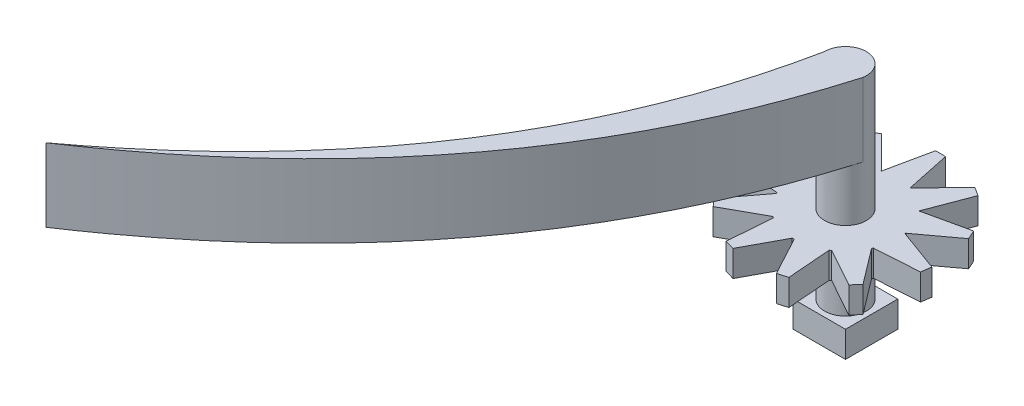
from build123d import *

# Parameters (mm, degrees)
ESQUISSE1_R             = 2
BOSS_EXTRU_1_DEPTH      = 5
ESQUISSE2_W             = 10
ESQUISSE2_H             = 10
BOSS_EXTRU_2_DEPTH      = 2.5
BOSS_EXTRU_3_DEPTH      = 7
BOSS_EXTRU_4_START      = 5
ESQUISSE5_R             = 2
BOSS_EXTRU_4_DEPTH      = 5
ESQUISSE6_W             = 5
ESQUISSE6_H             = 5
BOSS_EXTRU_5_DEPTH      = 2.5
ESQUISSE7_R             = 7.071067812
ESQUISSE7_R_2           = 5
ENL_V_MAT_EXTRU_1_DEPTH = 2.5
BOSS_EXTRU_6_DEPTH      = 2.5


# Read off the part's stored shape, not the designer's step: Boss.-Extru.3
with BuildPart() as part:
    # Esquisse1 → Boss.-Extru.1 (new body)
    with BuildSketch(Plane(origin=(0, 0, 0), x_dir=(1, 0, 0), z_dir=(0, 1, 0))):
        with Locations(Location((0, 0, 0), (0, 0, 270))):
            Circle(ESQUISSE1_R)
    extrude(amount=BOSS_EXTRU_1_DEPTH)

    # Esquisse2 → Boss.-Extru.2 (add)
    with BuildSketch(Plane.XZ):
        Rectangle(ESQUISSE2_W, ESQUISSE2_H)
    extrude(amount=BOSS_EXTRU_2_DEPTH)

    # Boss.-Extru.3 outline → Boss.-Extru.3 (add)
    with BuildSketch(Plane(origin=(0, 5, 0), x_dir=(1, 0, 0), z_dir=(0, 1, 0))):
        with BuildLine():
            ThreePointArc((1.9752398, -0.313731942), (0.157353741, 1.993800341), (-2, 0))
            add(Edge.make_bspline(
                [(-2, 0), (-7.431064096, -26.884767596), (-31.670728762, -44.785499484)],
                knots=[0, 0, 0, 1, 1, 1], degree=2))
            add(Edge.make_bspline(
                [(-31.670728762, -44.785499484), (-6.018007313, -27.755724693), (1.9752398, -0.313731942)],
                knots=[0.009012394, 0.009012394, 0.009012394, 1.009012394, 1.009012394, 1.009012394], degree=2))
        make_face()
    extrude(amount=BOSS_EXTRU_3_DEPTH)

    # Esquisse5 → Boss.-Extru.4 (add)
    with BuildSketch(Plane.XZ.offset(2.5).offset(BOSS_EXTRU_4_START)):
        with Locations(Location((0, 0, 0), (0, 0, 180))):
            Circle(ESQUISSE5_R)
    extrude(amount=-BOSS_EXTRU_4_DEPTH)

    # Esquisse6 → Boss.-Extru.5 (add)
    with BuildSketch(Plane.XZ.offset(7.5)):
        Rectangle(ESQUISSE6_W, ESQUISSE6_H)
    extrude(amount=BOSS_EXTRU_5_DEPTH)

    # Esquisse7 → Enlèv. mat.-Extru.1 (cut)
    with BuildSketch(Plane(origin=(0, 0, 0), x_dir=(1, 0, 0), z_dir=(0, 1, 0))):
        Circle(ESQUISSE7_R)
        with Locations(Location((0, 0, 0), (0, 0, 270))):
            Circle(ESQUISSE7_R_2, mode=Mode.SUBTRACT)
    extrude(amount=-ENL_V_MAT_EXTRU_1_DEPTH, mode=Mode.SUBTRACT)

    # Esquisse8 → Boss.-Extru.6 (add)
    with BuildSketch(Plane(origin=(0, 0, 0), x_dir=(1, 0, 0), z_dir=(0, 1, 0))):
        with BuildLine():
            Line((0.480722973, 9.091466817), (-0.480722973, 9.091466817))
            Line((-0.480722973, 9.091466817), (-1.384203057, 4.804579263))
            ThreePointArc((-1.384203057, 4.804579263), (0, 5), (1.384203057, 4.804579263))
            Line((1.384203057, 4.804579263), (0.480722973, 9.091466817))
        make_face()
        with BuildLine():
            ThreePointArc((-3.724002251, 3.336436308), (-2.657499069, 4.235292044), (-1.384203057, 4.804579263))
            Line((-1.384203057, 4.804579263), (-4.46192526, 7.922480352))
            Line((-4.46192526, 7.922480352), (-5.270745059, 7.40268343))
            Line((-5.270745059, 7.40268343), (-3.724002251, 3.336436308))
        make_face()
        with BuildLine():
            ThreePointArc((-4.929206832, 0.838403251), (-4.509599896, 2.159515866), (-3.743401614, 3.314655994))
            Line((-3.743401614, 3.314655994), (-7.98794375, 4.266868977))
            Line((-7.98794375, 4.266868977), (-8.38734283, 3.392306983))
            Line((-8.38734283, 3.392306983), (-4.929206832, 0.838403251))
        make_face()
        with BuildLine():
            ThreePointArc((-4.607625844, -1.941593182), (-4.962215179, -0.613531185), (-4.941763812, 0.760901064))
            Line((-4.941763812, 0.760901064), (-8.977846539, -0.714736526))
            Line((-8.977846539, -0.714736526), (-8.841018515, -1.666396338))
            Line((-8.841018515, -1.666396338), (-4.607625844, -1.941593182))
        make_face()
        with BuildLine():
            ThreePointArc((-2.816176348, -4.131482879), (-3.827716111, -3.216922344), (-4.554529885, -2.063069927))
            Line((-4.554529885, -2.063069927), (-7.117346486, -5.440711607))
            Line((-7.117346486, -5.440711607), (-6.487733289, -6.167323972))
            Line((-6.487733289, -6.167323972), (-2.816176348, -4.131482879))
        make_face()
        with BuildLine():
            Line((2.997139213, -8.410592571), (2.670641872, -4.227016914))
            ThreePointArc((2.670641872, -4.227016914), (1.435603167, -4.789472158), (0.094807796, -4.999101067))
            Line((0.094807796, -4.999101067), (2.074638584, -8.681463196))
            Line((2.074638584, -8.681463196), (2.997139213, -8.410592571))
        make_face()
        with BuildLine():
            Line((7.117346486, -5.440711607), (4.554529885, -2.063069927))
            ThreePointArc((4.554529885, -2.063069927), (3.827716111, -3.216922344), (2.816176348, -4.131482879))
            Line((2.816176348, -4.131482879), (6.487733289, -6.167323972))
            Line((6.487733289, -6.167323972), (7.117346486, -5.440711607))
        make_face()
        with BuildLine():
            Line((8.977846539, -0.714736526), (4.941763812, 0.760901064))
            ThreePointArc((4.941763812, 0.760901064), (4.985419694, 0.381563193), (5, 0))
            ThreePointArc((5, 0), (4.900924873, -0.990421825), (4.607625844, -1.941593182))
            Line((4.607625844, -1.941593182), (8.841018515, -1.666396338))
            Line((8.841018515, -1.666396338), (8.977846539, -0.714736526))
        make_face()
        with BuildLine():
            Line((7.98794375, 4.266868977), (3.743401614, 3.314655994))
            ThreePointArc((3.743401614, 3.314655994), (4.509599896, 2.159515866), (4.929206832, 0.838403251))
            Line((4.929206832, 0.838403251), (8.38734283, 3.392306983))
            Line((8.38734283, 3.392306983), (7.98794375, 4.266868977))
        make_face()
        with BuildLine():
            Line((4.46192526, 7.922480352), (1.384203057, 4.804579263))
            ThreePointArc((1.384203057, 4.804579263), (2.657499069, 4.235292044), (3.724002251, 3.336436308))
            Line((3.724002251, 3.336436308), (5.270745059, 7.40268343))
            Line((5.270745059, 7.40268343), (4.46192526, 7.922480352))
        make_face()
        with BuildLine():
            ThreePointArc((-0.094807796, -4.999101067), (-1.435603167, -4.789472158), (-2.670641872, -4.227016914))
            Line((-2.670641872, -4.227016914), (-2.997139213, -8.410592571))
            Line((-2.997139213, -8.410592571), (-2.074638584, -8.681463196))
            Line((-2.074638584, -8.681463196), (-0.094807796, -4.999101067))
        make_face()
    extrude(amount=-BOSS_EXTRU_6_DEPTH)


solid = part.part
